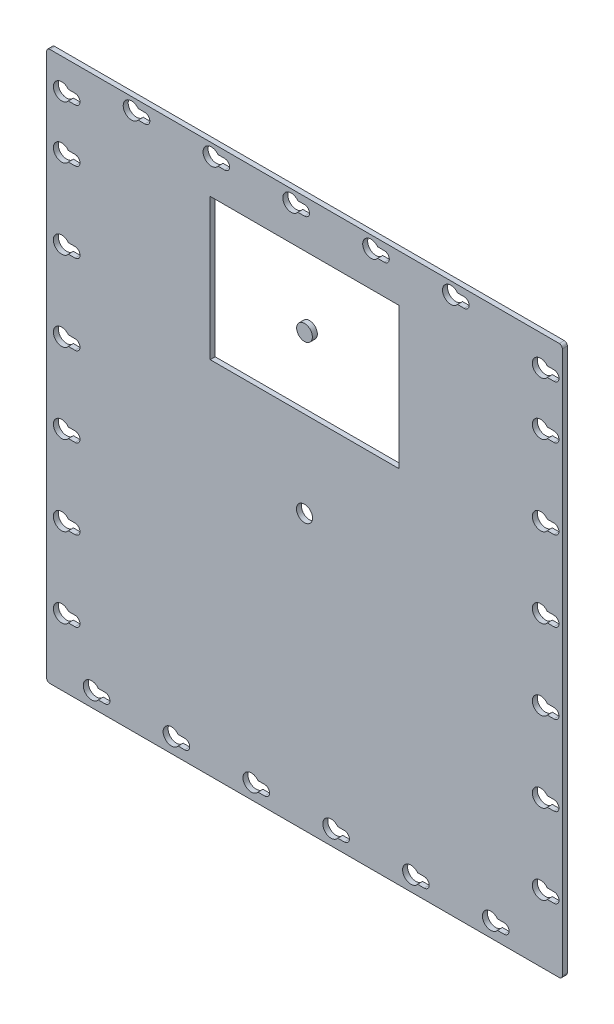
from build123d import *

# Parameters (mm, degrees)
SKETCH1_W           = 164.1
SKETCH1_H           = 174.745
SKETCH1_R           = 2.5527
BOSS_EXTRUDE1_DEPTH = 1.5875
FILLET1_R           = 1
SKETCH2_W           = 60
SKETCH2_H           = 45
SKETCH2_R           = 2.5
CUT_EXTRUDE1_DEPTH  = 10


with BuildPart() as part:
    # Sketch1 → Boss-Extrude1 (new body)
    with BuildSketch(Plane.XY):
        with Locations((82.55, -87.3725)):
            Rectangle(SKETCH1_W, SKETCH1_H)
        with Locations((82.55, -87.3725)):
            Circle(SKETCH1_R, mode=Mode.SUBTRACT)
        with BuildLine():
            Line((82.55, -5.4375), (80.434372699, -5.4375))
            ThreePointArc((80.434372699, -5.4375), (75.6625, -3.85), (80.434372699, -2.2625))
            Line((80.434372699, -2.2625), (82.55, -2.2625))
            ThreePointArc((82.55, -2.2625), (84.1375, -3.85), (82.55, -5.4375))
        make_face(mode=Mode.SUBTRACT)
        with BuildLine():
            Line((16.934372699, -168.395), (19.05, -168.395))
            ThreePointArc((19.05, -168.395), (20.6375, -169.9825), (19.05, -171.57))
            Line((19.05, -171.57), (16.934372699, -171.57))
            ThreePointArc((16.934372699, -171.57), (12.1625, -169.9825), (16.934372699, -168.395))
        make_face(mode=Mode.SUBTRACT)
        with BuildLine():
            Line((7.409372699, -151.9325), (9.525, -151.9325))
            ThreePointArc((9.525, -151.9325), (11.1125, -153.52), (9.525, -155.1075))
            Line((9.525, -155.1075), (7.409372699, -155.1075))
            ThreePointArc((7.409372699, -155.1075), (2.6375, -153.52), (7.409372699, -151.9325))
        make_face(mode=Mode.SUBTRACT)
        with BuildLine():
            Line((42.334372699, -168.395), (44.45, -168.395))
            ThreePointArc((44.45, -168.395), (46.0375, -169.9825), (44.45, -171.57))
            Line((44.45, -171.57), (42.334372699, -171.57))
            ThreePointArc((42.334372699, -171.57), (37.5625, -169.9825), (42.334372699, -168.395))
        make_face(mode=Mode.SUBTRACT)
        with BuildLine():
            Line((67.734372699, -168.395), (69.85, -168.395))
            ThreePointArc((69.85, -168.395), (71.4375, -169.9825), (69.85, -171.57))
            Line((69.85, -171.57), (67.734372699, -171.57))
            ThreePointArc((67.734372699, -171.57), (62.9625, -169.9825), (67.734372699, -168.395))
        make_face(mode=Mode.SUBTRACT)
        with BuildLine():
            Line((7.409372699, -126.5325), (9.525, -126.5325))
            ThreePointArc((9.525, -126.5325), (11.1125, -128.12), (9.525, -129.7075))
            Line((9.525, -129.7075), (7.409372699, -129.7075))
            ThreePointArc((7.409372699, -129.7075), (2.6375, -128.12), (7.409372699, -126.5325))
        make_face(mode=Mode.SUBTRACT)
        with BuildLine():
            Line((7.409372699, -101.1325), (9.525, -101.1325))
            ThreePointArc((9.525, -101.1325), (11.1125, -102.72), (9.525, -104.3075))
            Line((9.525, -104.3075), (7.409372699, -104.3075))
            ThreePointArc((7.409372699, -104.3075), (2.6375, -102.72), (7.409372699, -101.1325))
        make_face(mode=Mode.SUBTRACT)
        with BuildLine():
            Line((7.409372699, -75.7325), (9.525, -75.7325))
            ThreePointArc((9.525, -75.7325), (11.1125, -77.32), (9.525, -78.9075))
            Line((9.525, -78.9075), (7.409372699, -78.9075))
            ThreePointArc((7.409372699, -78.9075), (2.6375, -77.32), (7.409372699, -75.7325))
        make_face(mode=Mode.SUBTRACT)
        with BuildLine():
            Line((7.409372699, -50.3325), (9.525, -50.3325))
            ThreePointArc((9.525, -50.3325), (11.1125, -51.92), (9.525, -53.5075))
            Line((9.525, -53.5075), (7.409372699, -53.5075))
            ThreePointArc((7.409372699, -53.5075), (2.6375, -51.92), (7.409372699, -50.3325))
        make_face(mode=Mode.SUBTRACT)
        with BuildLine():
            Line((7.409372699, -24.9325), (9.525, -24.9325))
            ThreePointArc((9.525, -24.9325), (11.1125, -26.52), (9.525, -28.1075))
            Line((9.525, -28.1075), (7.409372699, -28.1075))
            ThreePointArc((7.409372699, -28.1075), (2.6375, -26.52), (7.409372699, -24.9325))
        make_face(mode=Mode.SUBTRACT)
        with BuildLine():
            Line((7.409372699, -8.1), (9.525, -8.1))
            ThreePointArc((9.525, -8.1), (11.1125, -9.6875), (9.525, -11.275))
            Line((9.525, -11.275), (7.409372699, -11.275))
            ThreePointArc((7.409372699, -11.275), (2.6375, -9.6875), (7.409372699, -8.1))
        make_face(mode=Mode.SUBTRACT)
        with BuildLine():
            Line((29.634372699, -2.2625), (31.75, -2.2625))
            ThreePointArc((31.75, -2.2625), (33.3375, -3.85), (31.75, -5.4375))
            Line((31.75, -5.4375), (29.634372699, -5.4375))
            ThreePointArc((29.634372699, -5.4375), (24.8625, -3.85), (29.634372699, -2.2625))
        make_face(mode=Mode.SUBTRACT)
        with BuildLine():
            Line((55.034372699, -2.2625), (57.15, -2.2625))
            ThreePointArc((57.15, -2.2625), (58.7375, -3.85), (57.15, -5.4375))
            Line((57.15, -5.4375), (55.034372699, -5.4375))
            ThreePointArc((55.034372699, -5.4375), (50.2625, -3.85), (55.034372699, -2.2625))
        make_face(mode=Mode.SUBTRACT)
        with BuildLine():
            ThreePointArc((161.925, -8.1), (163.5125, -9.6875), (161.925, -11.275))
            Line((161.925, -11.275), (159.809372699, -11.275))
            ThreePointArc((159.809372699, -11.275), (155.0375, -9.6875), (159.809372699, -8.1))
            Line((159.809372699, -8.1), (161.925, -8.1))
        make_face(mode=Mode.SUBTRACT)
        with BuildLine():
            Line((93.134372699, -168.395), (95.25, -168.395))
            ThreePointArc((95.25, -168.395), (96.8375, -169.9825), (95.25, -171.57))
            Line((95.25, -171.57), (93.134372699, -171.57))
            ThreePointArc((93.134372699, -171.57), (88.3625, -169.9825), (93.134372699, -168.395))
        make_face(mode=Mode.SUBTRACT)
        with BuildLine():
            Line((118.534372699, -168.395), (120.65, -168.395))
            ThreePointArc((120.65, -168.395), (122.2375, -169.9825), (120.65, -171.57))
            Line((120.65, -171.57), (118.534372699, -171.57))
            ThreePointArc((118.534372699, -171.57), (113.7625, -169.9825), (118.534372699, -168.395))
        make_face(mode=Mode.SUBTRACT)
        with BuildLine():
            Line((143.934372699, -168.395), (146.05, -168.395))
            ThreePointArc((146.05, -168.395), (147.6375, -169.9825), (146.05, -171.57))
            Line((146.05, -171.57), (143.934372699, -171.57))
            ThreePointArc((143.934372699, -171.57), (139.1625, -169.9825), (143.934372699, -168.395))
        make_face(mode=Mode.SUBTRACT)
        with BuildLine():
            Line((159.809372699, -151.9325), (161.925, -151.9325))
            ThreePointArc((161.925, -151.9325), (163.5125, -153.52), (161.925, -155.1075))
            Line((161.925, -155.1075), (159.809372699, -155.1075))
            ThreePointArc((159.809372699, -155.1075), (155.0375, -153.52), (159.809372699, -151.9325))
        make_face(mode=Mode.SUBTRACT)
        with BuildLine():
            Line((159.809372699, -126.5325), (161.925, -126.5325))
            ThreePointArc((161.925, -126.5325), (163.5125, -128.12), (161.925, -129.7075))
            Line((161.925, -129.7075), (159.809372699, -129.7075))
            ThreePointArc((159.809372699, -129.7075), (155.0375, -128.12), (159.809372699, -126.5325))
        make_face(mode=Mode.SUBTRACT)
        with BuildLine():
            Line((159.809372699, -101.1325), (161.925, -101.1325))
            ThreePointArc((161.925, -101.1325), (163.5125, -102.72), (161.925, -104.3075))
            Line((161.925, -104.3075), (159.809372699, -104.3075))
            ThreePointArc((159.809372699, -104.3075), (155.0375, -102.72), (159.809372699, -101.1325))
        make_face(mode=Mode.SUBTRACT)
        with BuildLine():
            Line((159.809372699, -75.7325), (161.925, -75.7325))
            ThreePointArc((161.925, -75.7325), (163.5125, -77.32), (161.925, -78.9075))
            Line((161.925, -78.9075), (159.809372699, -78.9075))
            ThreePointArc((159.809372699, -78.9075), (155.0375, -77.32), (159.809372699, -75.7325))
        make_face(mode=Mode.SUBTRACT)
        with BuildLine():
            Line((159.809372699, -50.3325), (161.925, -50.3325))
            ThreePointArc((161.925, -50.3325), (163.5125, -51.92), (161.925, -53.5075))
            Line((161.925, -53.5075), (159.809372699, -53.5075))
            ThreePointArc((159.809372699, -53.5075), (155.0375, -51.92), (159.809372699, -50.3325))
        make_face(mode=Mode.SUBTRACT)
        with BuildLine():
            Line((105.834372699, -2.2625), (107.95, -2.2625))
            ThreePointArc((107.95, -2.2625), (109.5375, -3.85), (107.95, -5.4375))
            Line((107.95, -5.4375), (105.834372699, -5.4375))
            ThreePointArc((105.834372699, -5.4375), (101.0625, -3.85), (105.834372699, -2.2625))
        make_face(mode=Mode.SUBTRACT)
        with BuildLine():
            Line((159.809372699, -24.9325), (161.925, -24.9325))
            ThreePointArc((161.925, -24.9325), (163.5125, -26.52), (161.925, -28.1075))
            Line((161.925, -28.1075), (159.809372699, -28.1075))
            ThreePointArc((159.809372699, -28.1075), (155.0375, -26.52), (159.809372699, -24.9325))
        make_face(mode=Mode.SUBTRACT)
        with BuildLine():
            Line((131.234372699, -2.2625), (133.35, -2.2625))
            ThreePointArc((133.35, -2.2625), (134.9375, -3.85), (133.35, -5.4375))
            Line((133.35, -5.4375), (131.234372699, -5.4375))
            ThreePointArc((131.234372699, -5.4375), (126.4625, -3.85), (131.234372699, -2.2625))
        make_face(mode=Mode.SUBTRACT)
    extrude(amount=BOSS_EXTRUDE1_DEPTH)

    # Fillet1
    fillet1_edges = [part.edges().sort_by_distance(p)[0] for p in [
        (0.5, -174.745, 0.79375),
        (0.5, 0, 0.79375),
        (164.6, 0, 0.79375),
        (164.6, -174.745, 0.79375),
    ]]
    fillet(fillet1_edges, radius=FILLET1_R)

    # Sketch2 → Cut-Extrude1 (cut)
    with BuildSketch(Plane.XY.offset(1.5875)):
        with Locations((82.55, -37.5)):
            Rectangle(SKETCH2_W, SKETCH2_H)
        with Locations((82.55, -37.5)):
            Circle(SKETCH2_R, mode=Mode.SUBTRACT)
    extrude(amount=-CUT_EXTRUDE1_DEPTH, mode=Mode.SUBTRACT)


with BuildPart() as cut_extrude1_piece_1:
    # of the separate pieces the step leaves, piece 1, a body of its own (cut_extrude1_pieces)
    add(part.part.solids().sort_by_distance((0.5, -1, 0))[0])


with BuildPart() as cut_extrude1_piece_2:
    # of the separate pieces the step leaves, piece 2, a body of its own (cut_extrude1_pieces)
    add(part.part.solids().sort_by_distance((85.05, -37.5, 0))[0])


solid = Compound([cut_extrude1_piece_1.part, cut_extrude1_piece_2.part])
